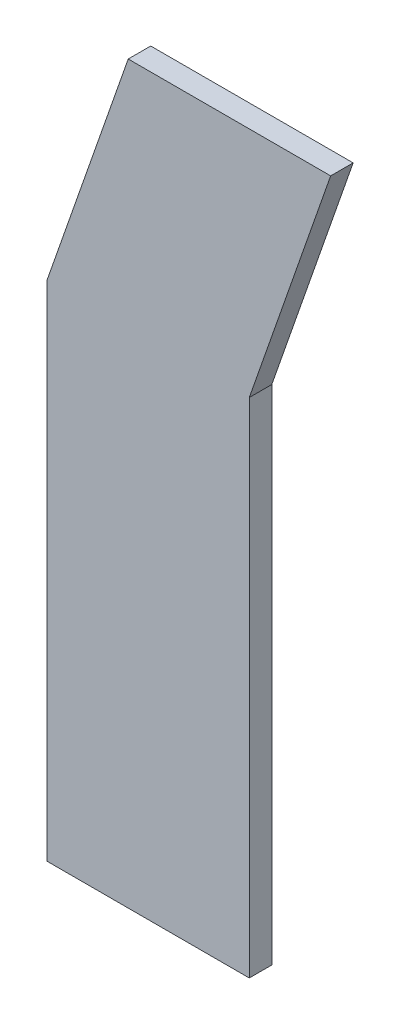
from build123d import *

# Parameters (mm, degrees)
BOSS_EXTRUDE1_DEPTH = 20


with BuildPart() as part:
    # Sketch1 → Boss-Extrude1 (new body)
    with BuildSketch(Plane.XY):
        Polygon((0, 0), (72.364312814, 206.871504278), (252.364312814, 206.871504278), (180, 0), (180, -447), (0, -447), align=None)
    extrude(amount=BOSS_EXTRUDE1_DEPTH)


solid = part.part
